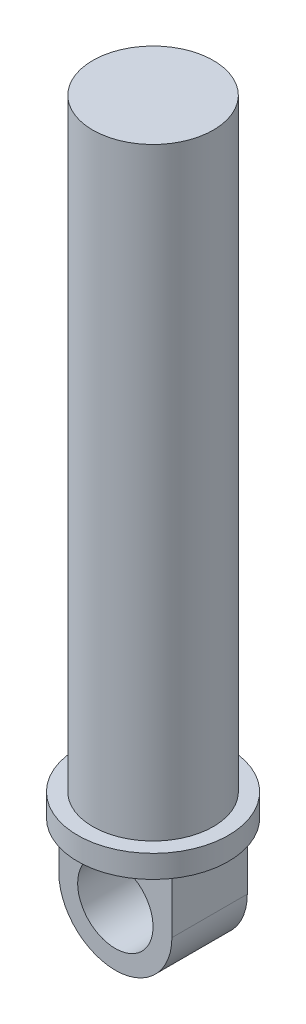
from build123d import *

# Parameters (mm, degrees)
SKETCH1_R           = 8
BOSS_EXTRUDE1_DEPTH = 80
SKETCH2_R           = 10
BOSS_EXTRUDE2_DEPTH = 3
SKETCH3_W           = 15
SKETCH3_H           = 10
BOSS_EXTRUDE3_DEPTH = 15
SKETCH4_R           = 5
CUT_EXTRUDE1_DEPTH  = 15
FILLET1_R           = 7.5


with BuildPart() as part:
    # Sketch1 → Boss-Extrude1 (new body)
    with BuildSketch(Plane(origin=(0, 0, 0), x_dir=(1, 0, 0), z_dir=(0, 1, 0))):
        with Locations(Location((0, 0, 0), (0, 0, 270))):
            Circle(SKETCH1_R)
    extrude(amount=BOSS_EXTRUDE1_DEPTH)

    # Sketch2 → Boss-Extrude2 (add)
    with BuildSketch(Plane.XZ):
        with Locations(Location((0, 0, 0), (0, 0, 270))):
            Circle(SKETCH2_R)
    extrude(amount=BOSS_EXTRUDE2_DEPTH)

    # Sketch3 → Boss-Extrude3 (add)
    with BuildSketch(Plane.XZ.offset(3)):
        Rectangle(SKETCH3_W, SKETCH3_H)
    extrude(amount=BOSS_EXTRUDE3_DEPTH)

    # Sketch4 → Cut-Extrude1 (cut)
    with BuildSketch(Plane(origin=(0, 0, -5), x_dir=(-1, 0, 0), z_dir=(0, 0, -1))):
        with Locations((0, -10.5)):
            Circle(SKETCH4_R)
    extrude(amount=-CUT_EXTRUDE1_DEPTH, mode=Mode.SUBTRACT)

    # Fillet1
    fillet1_edges = [part.edges().sort_by_distance(p)[0] for p in [
        (-7.5, -18, 0),
        (7.5, -18, 0),
    ]]
    fillet(fillet1_edges, radius=FILLET1_R - 0.0001)  # a hair under: the kernel refuses the full size


solid = part.part
